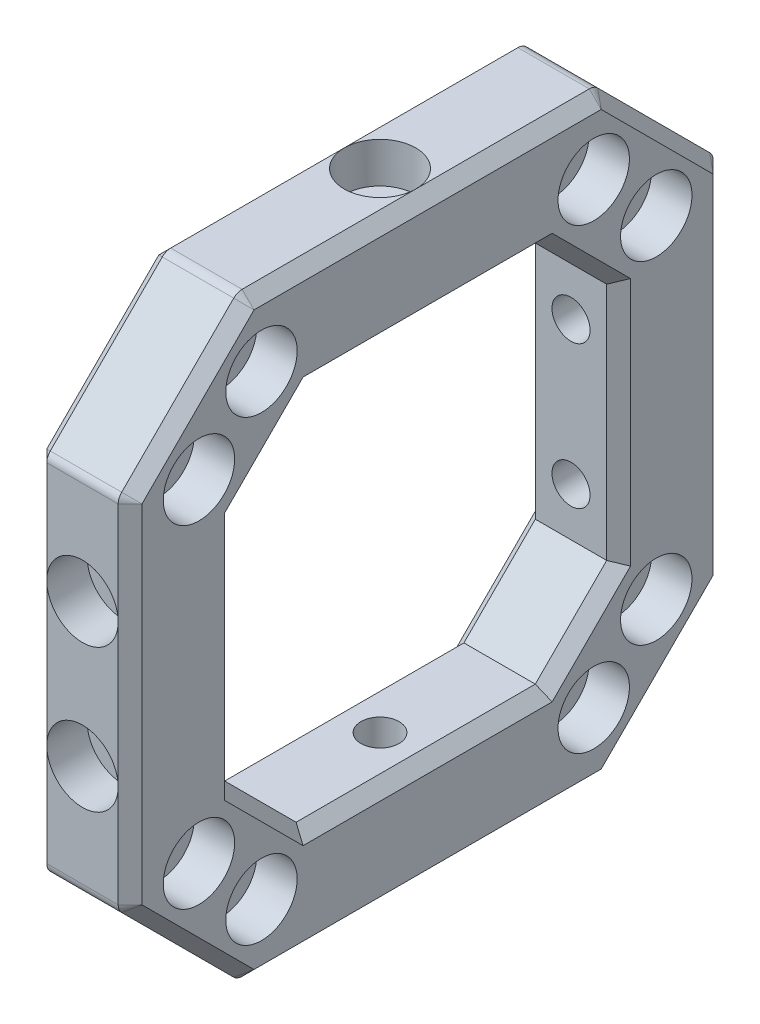
from build123d import *

# Parameters (mm, degrees)
SKETCH_1_W                   = 50
SKETCH_1_H                   = 50
SKETCH_1_W_2                 = 32.1
SKETCH_1_H_2                 = 32.1
EXTRUDE_1_DEPTH              = 8
CHAMFER_1_SIZE               = 10
CHAMFER_2_SIZE               = 6
HOLE_WIZARD_M3_1_D           = 3.2
HOLE_WIZARD_M3_1_CBORE_D     = 6
HOLE_WIZARD_M3_1_CBORE_DEPTH = 3.4
HOLE_WIZARD_M3_2_D           = 3.2
HOLE_WIZARD_M3_2_DEPTH       = 8.95
HOLE_WIZARD_M3_2_CBORE_D     = 6
HOLE_WIZARD_M3_2_CBORE_DEPTH = 3.4
HOLE_WIZARD_M3_3_D           = 3.2
HOLE_WIZARD_M3_3_DEPTH       = 8.95
HOLE_WIZARD_M3_3_CBORE_D     = 6
HOLE_WIZARD_M3_3_CBORE_DEPTH = 3.4
HOLE_WIZARD_M3_4_D           = 3.2
HOLE_WIZARD_M3_4_CBORE_D     = 6
HOLE_WIZARD_M3_4_CBORE_DEPTH = 3.4
HOLE_START                   = -25
HOLE_WIZARD_M3_5_OUTLINE_R   = 3
HOLE_WIZARD_M3_5_DEPTH       = 3.4
HOLE_START_2                 = -21.6
HOLE_WIZARD_M3_5_2_OUTLINE_R = 1.6
HOLE_WIZARD_M3_5_2_DEPTH     = 5.55
FILLET_1_R                   = 1
CHAMFER_4_SIZE               = 1


# Read off the part's stored shape, not the designer's step: M3 六角圆柱头螺钉的柱形沉头孔5
with BuildPart() as part:
    # 草图1 → 凸台-拉伸1 (new body)
    with BuildSketch(Plane(origin=(0, 0, 0), x_dir=(0, 0, -1), z_dir=(1, 0, 0))):
        Rectangle(SKETCH_1_W, SKETCH_1_H)
        Rectangle(SKETCH_1_W_2, SKETCH_1_H_2, mode=Mode.SUBTRACT)
    extrude(amount=EXTRUDE_1_DEPTH)

    # 倒角1
    chamfer_1_edges = [part.edges().sort_by_distance(p)[0] for p in [
        (4, -25, -25),
        (4, -25, 25),
        (4, 25, 25),
        (4, 25, -25),
    ]]
    chamfer(chamfer_1_edges, length=CHAMFER_1_SIZE)

    # 倒角2
    chamfer_2_edges = [part.edges().sort_by_distance(p)[0] for p in [
        (4, -16.05, -16.05),
        (4, 16.05, -16.05),
        (4, 16.05, 16.05),
        (4, -16.05, 16.05),
    ]]
    chamfer(chamfer_2_edges, length=CHAMFER_2_SIZE)

    # M3 六角圆柱头螺钉的柱形沉头孔1 (through all)
    with Locations(Plane(origin=(8, 0, 0), x_dir=(0, 0, -1), z_dir=(1, 0, 0))):
        with Locations((-13.959899742, 19.214153616), (13.959899742, 19.214153616), (19.214153616, -13.959899742), (-13.959899742, -19.214153616), (-19.214153616, 13.959899742), (19.214153616, 13.959899742), (13.959899742, -19.214153616), (-19.214153616, -13.959899742)):
            CounterBoreHole(HOLE_WIZARD_M3_1_D / 2, HOLE_WIZARD_M3_1_CBORE_D / 2, HOLE_WIZARD_M3_1_CBORE_DEPTH)

    # M3 六角圆柱头螺钉的柱形沉头孔2
    with Locations(Plane(origin=(0, 25, 0), x_dir=(1, 0, 0), z_dir=(0, 1, 0))):
        with Locations((4, 0)):
            CounterBoreHole(HOLE_WIZARD_M3_2_D / 2, HOLE_WIZARD_M3_2_CBORE_D / 2, HOLE_WIZARD_M3_2_CBORE_DEPTH, depth=HOLE_WIZARD_M3_2_DEPTH)

    # M3 六角圆柱头螺钉的柱形沉头孔3
    with Locations(Plane(origin=(0, 0, -25), x_dir=(-1, 0, 0), z_dir=(0, 0, -1))):
        with Locations((-4, 6), (-4, -6)):
            CounterBoreHole(HOLE_WIZARD_M3_3_D / 2, HOLE_WIZARD_M3_3_CBORE_D / 2, HOLE_WIZARD_M3_3_CBORE_DEPTH, depth=HOLE_WIZARD_M3_3_DEPTH)

    # M3 六角圆柱头螺钉的柱形沉头孔4 (through all)
    with Locations(Plane.XY.offset(25)):
        with Locations((4, -6), (4, 6)):
            CounterBoreHole(HOLE_WIZARD_M3_4_D / 2, HOLE_WIZARD_M3_4_CBORE_D / 2, HOLE_WIZARD_M3_4_CBORE_DEPTH)

    # M3 六角圆柱头螺钉的柱形沉头孔5 outline → M3 六角圆柱头螺钉的柱形沉头孔5 (cut)
    with BuildSketch(Plane(origin=(0, 0, 0), x_dir=(1, 0, 0), z_dir=(0, 1, 0)).offset(HOLE_START)):
        with Locations((4, 0)):
            Circle(HOLE_WIZARD_M3_5_OUTLINE_R)
    extrude(amount=HOLE_WIZARD_M3_5_DEPTH, mode=Mode.SUBTRACT)

    # Hole Wizard M3 _5 2 outline → Hole Wizard M3 _5 2 (cut)
    with BuildSketch(Plane(origin=(0, 0, 0), x_dir=(1, 0, 0), z_dir=(0, 1, 0)).offset(HOLE_START_2)):
        with Locations((4, 0)):
            Circle(HOLE_WIZARD_M3_5_2_OUTLINE_R)
    extrude(amount=HOLE_WIZARD_M3_5_2_DEPTH, mode=Mode.SUBTRACT)

    # 圆角1
    fillet_1_edges = [part.edges().sort_by_distance(p)[0] for p in [
        (4, -25, -15),
        (4, -25, 15),
        (4, 15, 25),
        (4, -15, 25),
        (4, 15, -25),
        (4, -15, -25),
        (4, 25, 15),
        (4, 25, -15),
    ]]
    fillet(fillet_1_edges, radius=FILLET_1_R)

    # 倒角4
    chamfer_4_edges = [part.edges().sort_by_distance(p)[0] for p in [
        (8, 25, 0),
        (0, 25, 0),
        (8, 0, 25),
        (8, -20, 20),
        (8, -25, 0),
        (8, -20, -20),
        (8, 0, -25),
        (8, 20, -20),
        (8, 20, 20),
        (8, -14.96846987, 24.923879533),
        (8, -24.923879533, 14.96846987),
        (8, -24.923879533, -14.96846987),
        (8, -14.96846987, -24.923879533),
        (8, 14.96846987, -24.923879533),
        (8, 24.923879533, -14.96846987),
        (8, 14.96846987, 24.923879533),
        (8, 24.923879533, 14.96846987),
        (0, 20, 20),
        (0, -25, 0),
        (0, -20, 20),
        (0, 0, 25),
        (0, 20, -20),
        (0, 0, -25),
        (0, -20, -20),
        (0, -14.96846987, 24.923879533),
        (0, -24.923879533, 14.96846987),
        (0, -24.923879533, -14.96846987),
        (0, -14.96846987, -24.923879533),
        (0, 14.96846987, -24.923879533),
        (0, 24.923879533, -14.96846987),
        (0, 14.96846987, 24.923879533),
        (0, 24.923879533, 14.96846987),
        (0, 0, 16.05),
        (8, 0, 16.05),
        (0, -16.05, 0),
        (8, -16.05, 0),
        (0, 0, -16.05),
        (8, 0, -16.05),
        (0, 16.05, 0),
        (8, 16.05, 0),
        (0, -13.05, 13.05),
        (8, -13.05, 13.05),
        (0, -13.05, -13.05),
        (8, -13.05, -13.05),
        (0, 13.05, -13.05),
        (8, 13.05, -13.05),
        (0, 13.05, 13.05),
        (8, 13.05, 13.05),
    ]]
    chamfer(chamfer_4_edges, length=CHAMFER_4_SIZE - 0.0001)  # a hair under: the kernel refuses the full size


solid = part.part
